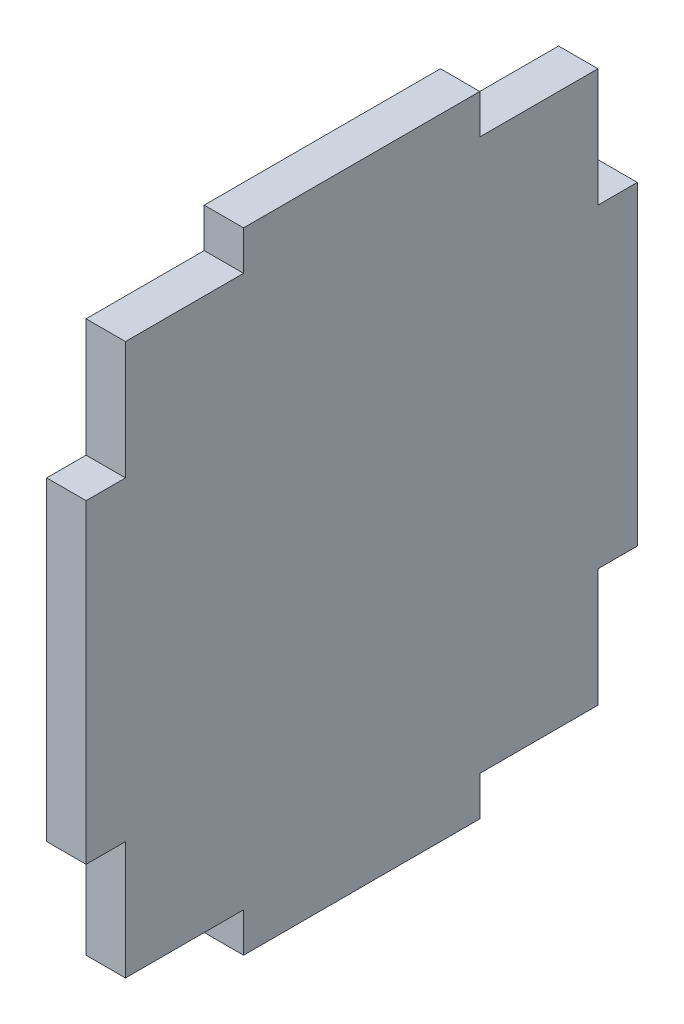
from build123d import *

# Parameters (mm, degrees)
SKETCH1_W                                = 70
SKETCH1_H                                = 80
BOSS_EXTRUDE1_DEPTH                      = 5
CUT_EXTRUDE1_DEPTH                       = 54.38539126
MIRROR1_AT_THE_SECOND_PLANE_COPY_1_DEPTH = 54.38539126


with BuildPart() as part:
    # Sketch1 → Boss-Extrude1 (new body)
    with BuildSketch(Plane(origin=(0, 0, 0), x_dir=(0, 0, -1), z_dir=(1, 0, 0))):
        Rectangle(SKETCH1_W, SKETCH1_H)
    extrude(amount=BOSS_EXTRUDE1_DEPTH)

    # Sketch3 → Cut-Extrude1 (cut, symmetric)
    with BuildSketch(Plane(origin=(5, 0, 0), x_dir=(0, 0, -1), z_dir=(1, 0, 0))):
        Polygon((-35, 20), (-30, 20), (-30, 35), (-15, 35), (-15, 40), (-35, 40), align=None)
    cut_extrude1 = extrude(amount=CUT_EXTRUDE1_DEPTH, both=True, mode=Mode.SUBTRACT)

    # Mirror1: Cut-Extrude1 across plane
    add(cut_extrude1.mirror(Plane.XY), mode=Mode.SUBTRACT)

    # Mirror1 at the second plane: Cut-Extrude1 across plane
    add(cut_extrude1.mirror(Plane.ZX), mode=Mode.SUBTRACT)

    # Mirror1 at the second plane copy 1 sketc → Mirror1 at the second plane copy 1 (cut, symmetric)
    with BuildSketch(Plane(origin=(5, 0, 0), x_dir=(0, 0, 1), z_dir=(1, 0, 0))):
        Polygon((-35, 20), (-30, 20), (-30, 35), (-15, 35), (-15, 40), (-35, 40), align=None)
    extrude(amount=MIRROR1_AT_THE_SECOND_PLANE_COPY_1_DEPTH, both=True, mode=Mode.SUBTRACT)


solid = part.part
